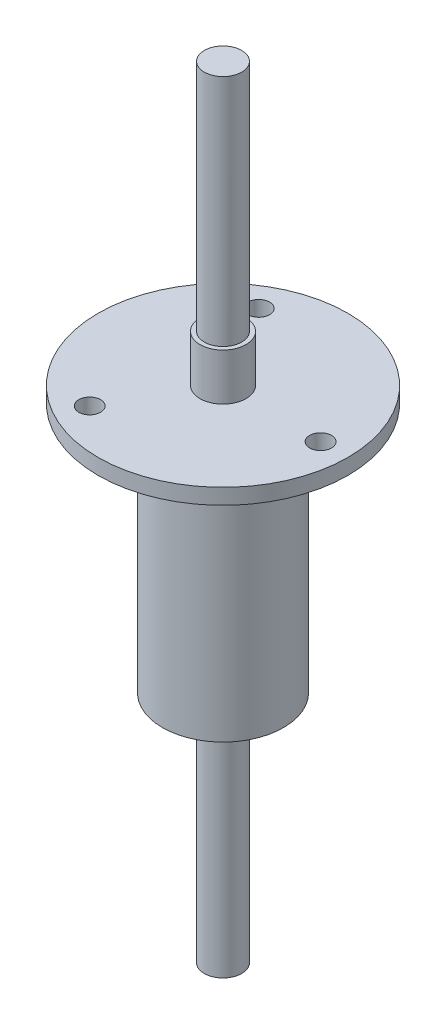
from build123d import *

# Parameters (mm, degrees)
CUT_EXTRUDE1_DEPTH      = 41.924442574
CUT_EXTRUDE1_DEPTH_BACK = 41.924442574
SKETCH2_R               = 1.4
SKETCH3_R               = 2.4
BOSS_EXTRUDE1_DEPTH     = 50


with BuildPart() as part:
    # Sketch1 → Revolve1 (revolve)
    with BuildSketch(Plane(origin=(0, 0, 0), x_dir=(0, 0, -1), z_dir=(1, 0, 0))):
        Polygon((0, 20.05), (2.95, 20.05), (2.95, 14.05), (16, 14.05), (16, 12.05), (7.75, 12.05), (7.75, -20.05), (0, -20.05), align=None)
    revolve(axis=Axis((0, 23.931122449, 0), (0, -1, 0)))

    # Sketch2 → Cut-Extrude1 (cut, two sides: drawn at the far end of the back side and taken through both)
    with BuildSketch(Plane(origin=(0, 14.05, 0), x_dir=(1, 0, 0), z_dir=(0, 1, 0)).offset(-CUT_EXTRUDE1_DEPTH_BACK)):
        with Locations((12.5, 0)):
            Circle(SKETCH2_R)
        with Locations((-6.25, -10.825317547)):
            Circle(SKETCH2_R)
        with Locations((-6.25, 10.825317547)):
            Circle(SKETCH2_R)
    extrude(amount=CUT_EXTRUDE1_DEPTH + CUT_EXTRUDE1_DEPTH_BACK, mode=Mode.SUBTRACT)

    # Sketch3 → Boss-Extrude1 (add, symmetric)
    with BuildSketch(Plane(origin=(0, 0, 0), x_dir=(1, 0, 0), z_dir=(0, 1, 0))):
        Circle(SKETCH3_R)
    extrude(amount=BOSS_EXTRUDE1_DEPTH, both=True)


with BuildPart() as body_2:
    # Split1: the piece on the far side of the plane
    add(part.part)
    split(bisect_by=Plane(origin=(0, 14.05, -2.95), x_dir=(0, 0, -1), z_dir=(0, -1, 0)), keep=Keep.BOTTOM)


with BuildPart() as part_1:
    add(part.part)

    # Split1
    split(bisect_by=Plane(origin=(0, 14.05, -2.95), x_dir=(0, 0, -1), z_dir=(0, -1, 0)), keep=Keep.TOP)


solid = Compound([body_2.part, part_1.part])
